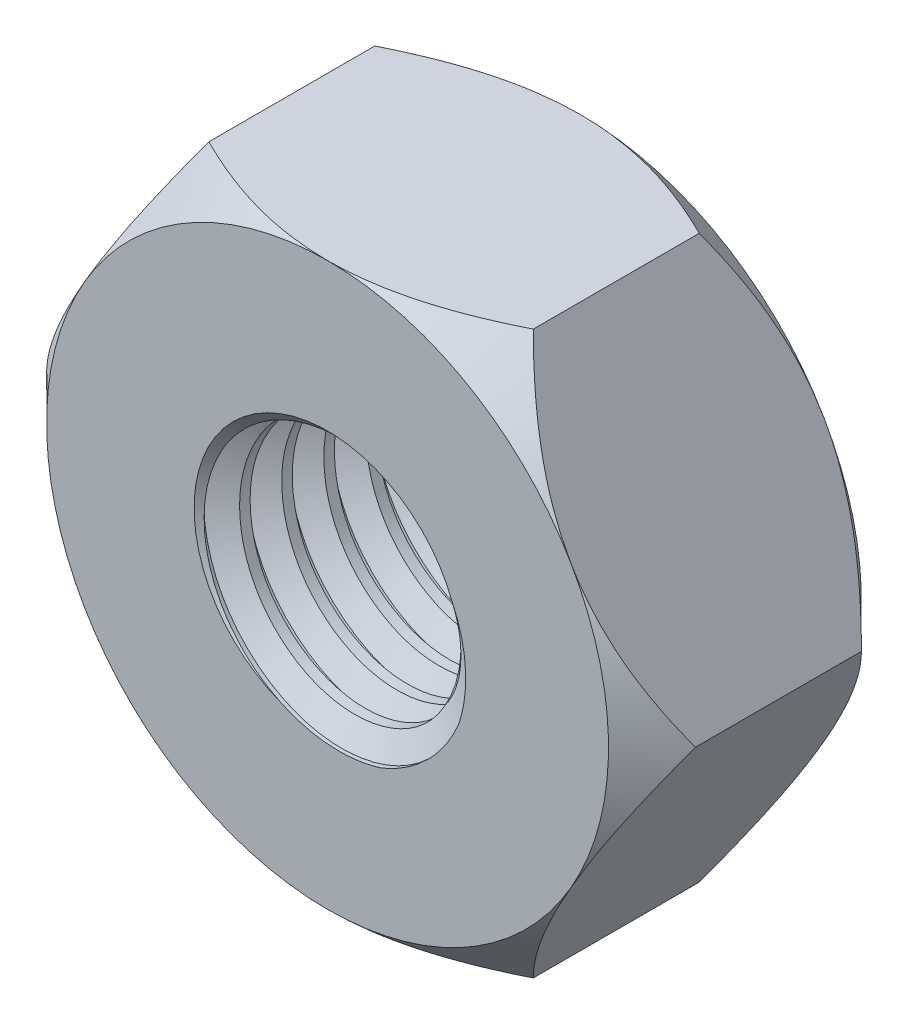
from build123d import *

# Parameters (mm, degrees)
BOSS_EXTRUDE1_DEPTH     = 4.5
SKETCH2_OUTSIDE_W       = 68.922
SKETCH2_OUTSIDE_H       = 65.828
SKETCH2_OUTSIDE_R       = 10
CUT_EXTRUDE1_DEPTH      = 18.729448196
CUT_EXTRUDE1_DRAFT      = -45
MIRROR1_COPY_1_SKETCH_W = 68.922
MIRROR1_COPY_1_SKETCH_H = 65.828
MIRROR1_COPY_1_SKETCH_R = 10
MIRROR1_COPY_1_DEPTH    = 18.729448196
MIRROR1_COPY_1_DRAFT    = -45
SKETCH3_R               = 4.25
CUT_EXTRUDE2_DEPTH      = 18.729448196
CHAMFER1_SIZE           = 0.5
THREAD1_PITCH           = 1.5


with BuildPart() as part:
    # Sketch1 → Boss-Extrude1 (new, symmetric)
    with BuildSketch(Plane.XY):
        Polygon((11.547005384, 0), (5.773502692, 10), (-5.773502692, 10), (-11.547005384, 0), (-5.773502692, -10), (5.773502692, -10), align=None)
    extrude(amount=BOSS_EXTRUDE1_DEPTH, both=True)


with BuildPart() as cut_extrude1_tool:
    # Sketch2 outside → Cut-Extrude1 (with draft: the straight prism first)
    with BuildSketch(Plane.XY.offset(4.5)):
        Rectangle(SKETCH2_OUTSIDE_W, SKETCH2_OUTSIDE_H)
        Circle(SKETCH2_OUTSIDE_R, mode=Mode.SUBTRACT)
    extrude(amount=-CUT_EXTRUDE1_DEPTH)
    # Cut-Extrude1: the draft: its side faces are tilted about the plane it starts from
    cut_extrude1_sides = [cut_extrude1_tool.faces().sort_by_distance(p)[0] for p in [
        (0, -32.914, -4.864724098),
        (34.461, 0, -4.864724098),
        (0, 32.914, -4.864724098),
        (-34.461, 0, -4.864724098),
        (-10, 0, -4.864724098),
    ]]
    draft(cut_extrude1_sides, Plane.XY.offset(4.5), CUT_EXTRUDE1_DRAFT)


with BuildPart() as part_1:
    add(part.part)

    # Cut-Extrude1: cut by cut_extrude1_tool
    add(cut_extrude1_tool.part, mode=Mode.SUBTRACT)


with BuildPart() as mirror1_copy_1_tool:
    # Mirror1 copy 1 sketch → Mirror1 copy 1 (with draft: the straight prism first)
    with BuildSketch(Plane(origin=(0, 0, -4.5), x_dir=(1, 0, 0), z_dir=(0, 0, -1))):
        Rectangle(MIRROR1_COPY_1_SKETCH_W, MIRROR1_COPY_1_SKETCH_H)
        Circle(MIRROR1_COPY_1_SKETCH_R, mode=Mode.SUBTRACT)
    extrude(amount=-MIRROR1_COPY_1_DEPTH)
    # Mirror1 copy 1: the draft: its side faces are tilted about the plane it starts from
    mirror1_copy_1_sides = [mirror1_copy_1_tool.faces().sort_by_distance(p)[0] for p in [
        (0, -32.914, 4.864724098),
        (34.461, 0, 4.864724098),
        (0, 32.914, 4.864724098),
        (-34.461, 0, 4.864724098),
        (-10, 0, 4.864724098),
    ]]
    draft(mirror1_copy_1_sides, Plane(origin=(0, 0, -4.5), x_dir=(1, 0, 0), z_dir=(0, 0, -1)), MIRROR1_COPY_1_DRAFT)


with BuildPart() as part_2:
    add(part_1.part)

    # Mirror1 copy 1: cut by mirror1_copy_1_tool
    add(mirror1_copy_1_tool.part, mode=Mode.SUBTRACT)

    # Sketch3 → Cut-Extrude2 (cut, through all)
    with BuildSketch(Plane.XY.offset(4.5)):
        Circle(SKETCH3_R)
    extrude(amount=-CUT_EXTRUDE2_DEPTH, mode=Mode.SUBTRACT)

    # Chamfer1
    chamfer1_edges = [part_2.edges().sort_by_distance(p)[0] for p in [
        (-4.25, 0, -4.5),
        (-4.25, 0, 4.5),
    ]]
    chamfer(chamfer1_edges, length=CHAMFER1_SIZE)

    # Thread1: the profile of Thread Profile3 profile screwed along a right-hand helix of 7 turns, 8 arcs to a turn; built about Z, then put on its axis
    thread1_z = Axis((0, 0, 0), (0, 0, 1))
    thread1_corners = [(4.2497, 0, -0.000173205), (5.061898812, 0, 0.468749998), (5.061898812, 0, 0.656249998), (4.2497, 0, 1.125173201)]
    with BuildLine(mode=Mode.PRIVATE) as thread1_profile:
        Line(thread1_corners[0], thread1_corners[1])
        Line(thread1_corners[1], thread1_corners[2])
        Line(thread1_corners[2], thread1_corners[3])
        Line(thread1_corners[3], thread1_corners[0])
    thread1_cap = Face(thread1_profile.wire())
    thread1_turn_angles = [0, 22.5, 45, 67.5, 90, 112.5, 135, 157.5, 180, 202.5, 225, 247.5, 270, 292.5, 315, 337.5, 360]
    thread1_turn_weights = [1, 0.9238795325112867, 1, 0.9238795325112867, 1, 0.9238795325112867, 1, 0.9238795325112867, 1, 0.9238795325112867, 1, 0.9238795325112867, 1, 0.9238795325112867, 1, 0.9238795325112867, 1]
    thread1_turn_rails = [Edge.make_bspline([Vector(p[0], p[1], 0).rotate(thread1_z, thread1_turn_angles[k]) / thread1_turn_weights[k] + Vector(0, 0, p[2] + THREAD1_PITCH * thread1_turn_angles[k] / 360) for k in range(17)], [0, 0, 0, 1, 1, 2, 2, 3, 3, 4, 4, 5, 5, 6, 6, 7, 7, 8, 8, 8], 2, thread1_turn_weights) for p in thread1_corners]
    thread1_turn_sides = [Face.make_surface_from_curves(thread1_turn_rails[p[0]], thread1_turn_rails[p[1]]) for p in [(0, 1), (1, 2), (2, 3), (3, 0)]]
    thread1 = Plane(origin=(0, 0, 6), x_dir=(-1, 0, 0), z_dir=(0, 0, -1)) * Solid(Shell([*[p.moved(Location((0, 0, THREAD1_PITCH * i))) for i in range(7) for p in thread1_turn_sides], thread1_cap, thread1_cap.rotate(thread1_z, 2520).moved(Location((0, 0, THREAD1_PITCH * 2520 / 360)))]))
    add(thread1, mode=Mode.SUBTRACT)


solid = part_2.part
